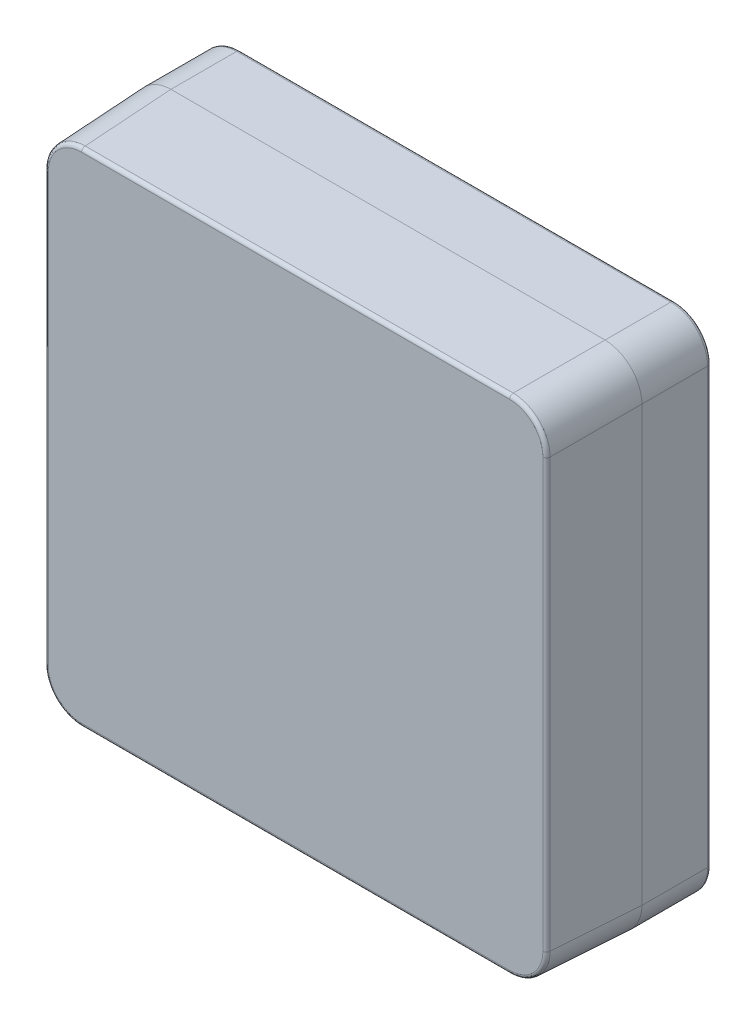
from build123d import *

# Parameters (mm, degrees)
SKETCH1_W           = 34.925
SKETCH1_H           = 34.925
BOSS_EXTRUDE1_DEPTH = 6.35
DRAFT2_START        = -17.4625
DRAFT2_DEPTH        = 34.925
DRAFT2_START_2      = -18
DRAFT2_2_DEPTH      = 36
SKETCH2_W           = 34.925
SKETCH2_H           = 34.925
BOSS_EXTRUDE2_DEPTH = 4.7625
SHELL1_START        = -14.2875
SHELL1_DEPTH        = 28.575
SHELL1_START_2      = -15
SHELL1_2_DEPTH      = 30
FILLET1_R           = 2.54
FILLET2_R           = 0.254


with BuildPart() as part:
    # Sketch1 → Boss-Extrude1 (new body)
    with BuildSketch(Plane.XY):
        Rectangle(SKETCH1_W, SKETCH1_H)
    extrude(amount=BOSS_EXTRUDE1_DEPTH)

    # Draft2: read off the stored shape, not the designer's step
    # Draft2 outline → Draft2 (cut)
    with BuildSketch(Plane(origin=(0, 0, 0), x_dir=(1, 0, 0), z_dir=(0, 1, 0)).offset(DRAFT2_START)):
        Polygon((17.4625, 0), (17.240753114, -6.35), (17.4625, -6.35), align=None)
        Polygon((-17.240753114, -6.35), (-17.4625, 0), (-17.4625, -6.35), align=None)
    extrude(amount=DRAFT2_DEPTH, mode=Mode.SUBTRACT)

    # Draft2 2 outline → Draft2 2 (cut)
    with BuildSketch(Plane.YZ.offset(DRAFT2_START_2)):
        Polygon((17.4625, 6.35), (17.240753114, 6.35), (17.4625, 0), align=None)
        Polygon((-17.4625, 0), (-17.240753114, 6.35), (-17.4625, 6.35), align=None)
    extrude(amount=DRAFT2_2_DEPTH, mode=Mode.SUBTRACT)

    # Sketch2 → Boss-Extrude2 (add)
    with BuildSketch(Plane(origin=(0, 0, 0), x_dir=(-1, 0, 0), z_dir=(0, 0, -1))):
        Rectangle(SKETCH2_W, SKETCH2_H)
    extrude(amount=BOSS_EXTRUDE2_DEPTH)

    # Shell1: read off the stored shape, not the designer's step
    # Shell1 outline → Shell1 (cut)
    with BuildSketch(Plane(origin=(0, 0, 0), x_dir=(1, 0, 0), z_dir=(0, 1, 0)).offset(SHELL1_START)):
        Polygon((-14.2875, 4.7625), (-14.2875, 0.055419831), (-14.230127975, -1.5875), (14.230127975, -1.5875), (14.2875, 0.055419831), (14.2875, 4.7625), align=None)
    extrude(amount=SHELL1_DEPTH, mode=Mode.SUBTRACT)

    # Shell1 2 outline → Shell1 2 (add)
    with BuildSketch(Plane.YZ.offset(SHELL1_START_2)):
        Polygon((14.2875, 1.5875), (14.230127975, 1.5875), (14.2875, -0.055419831), align=None)
        Polygon((-14.2875, -0.055419831), (-14.230127975, 1.5875), (-14.2875, 1.5875), align=None)
    extrude(amount=SHELL1_2_DEPTH)

    # Fillet1
    # the kernel refuses this fillet: 2.54 mm, written as the material it takes off along each edge
    with BuildSketch(Plane(origin=(17.4625, -17.4625, 6.35), x_dir=(0, 1, 0), z_dir=(0, 0, -1)), Plane(origin=(17.4625, 17.4625, 6.35), x_dir=(-1, 0, 0), z_dir=(0, 0, -1))) as fillet1_piece_1:
        with BuildLine():
            CenterArc((FILLET1_R, -FILLET1_R), FILLET1_R, 90, 90)
            Line((0, -FILLET1_R), (0, 0))
            Line((0, 0), (FILLET1_R, 0))
        make_face()
    extrude(amount=17.4625, mode=Mode.SUBTRACT)
    with BuildSketch(Plane(origin=(-17.4625, -17.4625, 6.35), x_dir=(0, 1, 0), z_dir=(0, 0, -1)), Plane(origin=(-17.4625, 17.4625, 6.35), x_dir=(1, 0, 0), z_dir=(0, 0, -1))) as fillet1_piece_2:
        with BuildLine():
            CenterArc((FILLET1_R, FILLET1_R), FILLET1_R, 180, 90)
            Line((0, FILLET1_R), (0, 0))
            Line((0, 0), (FILLET1_R, 0))
        make_face()
    extrude(amount=17.4625, mode=Mode.SUBTRACT)
    with BuildSketch(Plane(origin=(-17.019545735, 17.019545735, 12.684550536), x_dir=(0.9993915683009627, 0.001217233812578861, -0.034857015804396825), z_dir=(-0.0348782626996021, 0.0348782626996021, -0.9987827659617056)), Plane(origin=(17.683707379, 17.683707379, -6.334550536), x_dir=(-0.9993915683009624, 0.0012172338125788487, -0.03485701580439681), z_dir=(-0.0348782626996021, -0.0348782626996021, 0.9987827659617056))) as fillet1_piece_3:
        with BuildLine():
            CenterArc((FILLET1_R * 0.998782765962, FILLET1_R), FILLET1_R, 180.069784837, 89.930215163)
            Line((-FILLET1_R * 0.00121649230663, FILLET1_R * 0.998782025133), (0, 0))
            Line((0, 0), (FILLET1_R * 0.998782765962, 0))
        make_face()
    extrude(amount=19.042279984, mode=Mode.SUBTRACT)
    with BuildSketch(Plane(origin=(17.019545735, -17.019545735, 12.684550536), x_dir=(0.001217233812578861, 0.9993915683009627, -0.034857015804396825), z_dir=(0.0348782626996021, -0.0348782626996021, -0.9987827659617056)), Plane(origin=(-17.683707379, -17.683707379, -6.334550536), x_dir=(-0.001217233812578861, 0.9993915683009627, -0.034857015804396825), z_dir=(0.0348782626996021, 0.0348782626996021, 0.9987827659617056))) as fillet1_piece_4:
        with BuildLine():
            CenterArc((FILLET1_R * 0.998782765962, -FILLET1_R), FILLET1_R, 90, 89.930215163)
            Line((-FILLET1_R * 0.00121649230663, -FILLET1_R * 0.998782025133), (0, 0))
            Line((0, 0), (FILLET1_R * 0.998782765962, 0))
        make_face()
    extrude(amount=19.042279984, mode=Mode.SUBTRACT)

    # Fillet2
    fillet2_edges = [part.edges().sort_by_distance(p)[0] for p in [
        (17.240753114, 0, 6.35),
        (0, -17.240753114, 6.35),
        (-17.240753114, 0, 6.35),
        (0, 17.240753114, 6.35),
        (-16.497444975, -16.497444975, 6.35),
        (-16.497444975, 16.497444975, 6.35),
        (16.497444975, 16.497444975, 6.35),
        (16.497444975, -16.497444975, 6.35),
        (0, -17.4625, -4.7625),
        (17.4625, 0, -4.7625),
        (-17.4625, 0, -4.7625),
        (0, 17.4625, -4.7625),
        (-16.718551224, -16.718551224, -4.7625),
        (-16.718551224, 16.718551224, -4.7625),
        (16.718551224, 16.718551224, -4.7625),
        (16.718551224, -16.718551224, -4.7625),
    ]]
    fillet(fillet2_edges, radius=FILLET2_R)


solid = part.part
